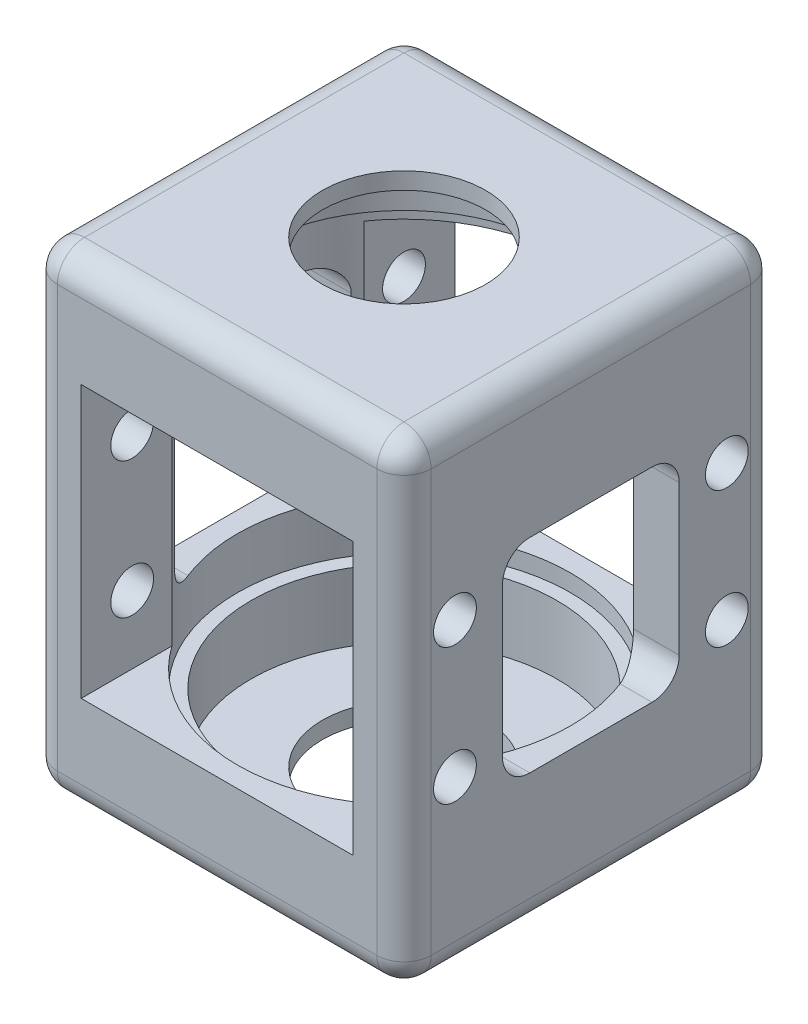
from build123d import *

# Parameters (mm, degrees)
SKETCH1_W               = 34.925
SKETCH1_H               = 34.925
SKETCH1_R               = 7.62
BOSS_EXTRUDE1_DEPTH     = 44.45
SKETCH2_W               = 25.4
SKETCH2_H               = 25.4
CUT_EXTRUDE1_DEPTH      = 44.45
CUT_EXTRUDE2_DEPTH      = 27.0002
CUT_EXTRUDE2_DEPTH_BACK = 1.6002
SKETCH3_R               = 15.5575
CUT_EXTRUDE3_DEPTH      = 34.9504
CUT_EXTRUDE3_DEPTH_BACK = 6.35
SKETCH4_R               = 14.2875
SKETCH5_W               = 16.51
SKETCH5_H               = 19.05
CUT_EXTRUDE4_DEPTH      = 228.6
SKETCH6_R               = 2
CUT_EXTRUDE5_DEPTH      = 228.6
FILLET1_R               = 2.54


with BuildPart() as part:
    # Sketch1 → Boss-Extrude1 (new body)
    with BuildSketch(Plane(origin=(0, 0, 0), x_dir=(1, 0, 0), z_dir=(0, 1, 0))):
        Rectangle(SKETCH1_W, SKETCH1_H)
        Circle(SKETCH1_R, mode=Mode.SUBTRACT)
    extrude(amount=BOSS_EXTRUDE1_DEPTH)

    # Sketch2 → Cut-Extrude1 (cut)
    with BuildSketch(Plane.XY.offset(17.4625)):
        with Locations((0, 22.225)):
            Rectangle(SKETCH2_W, SKETCH2_H)
    extrude(amount=-CUT_EXTRUDE1_DEPTH, mode=Mode.SUBTRACT)

    # Sketch3 → Cut-Extrude2 (cut, two sides: drawn at the far end of the back side and taken through both)
    with BuildSketch(Plane(origin=(0, 9.525, 0), x_dir=(1, 0, 0), z_dir=(0, 1, 0)).offset(-CUT_EXTRUDE2_DEPTH_BACK)):
        Circle(SKETCH3_R)
    extrude(amount=CUT_EXTRUDE2_DEPTH + CUT_EXTRUDE2_DEPTH_BACK, mode=Mode.SUBTRACT)

    # Sketch4 → Cut-Extrude3 (cut, two sides: drawn at the far end of the back side and taken through both)
    with BuildSketch(Plane(origin=(0, 7.9248, 0), x_dir=(1, 0, 0), z_dir=(0, 1, 0)).offset(-CUT_EXTRUDE3_DEPTH_BACK)):
        Circle(SKETCH4_R)
    extrude(amount=CUT_EXTRUDE3_DEPTH + CUT_EXTRUDE3_DEPTH_BACK, mode=Mode.SUBTRACT)

    # Sketch5 → Cut-Extrude4 (cut)
    with BuildSketch(Plane.ZY.offset(17.4625)):
        with Locations((0, 22.225)):
            Rectangle(SKETCH5_W, SKETCH5_H)
    extrude(amount=-CUT_EXTRUDE4_DEPTH, mode=Mode.SUBTRACT)

    # Sketch6 → Cut-Extrude5 (cut)
    with BuildSketch(Plane.ZY.offset(17.4625)):
        with Locations((-12.7, 28.575)):
            Circle(SKETCH6_R)
        with Locations((-12.7, 15.875)):
            Circle(SKETCH6_R)
        with Locations((12.7, 15.875)):
            Circle(SKETCH6_R)
        with Locations((12.7, 28.575)):
            Circle(SKETCH6_R)
    extrude(amount=-CUT_EXTRUDE5_DEPTH, mode=Mode.SUBTRACT)

    # Fillet1
    fillet1_edges = [part.edges().sort_by_distance(p)[0] for p in [
        (15.324632691, 12.7, 8.255),
        (15.324632691, 12.7, -8.255),
        (15.324632691, 31.75, 8.255),
        (15.324632691, 31.75, -8.255),
        (-17.4625, 0, 0),
        (-17.4625, 22.225, 17.4625),
        (0, 44.45, 17.4625),
        (17.4625, 44.45, 0),
        (17.4625, 22.225, 17.4625),
        (0, 0, 17.4625),
        (0, 0, -17.4625),
        (17.4625, 0, 0),
        (17.4625, 22.225, -17.4625),
        (-17.4625, 22.225, -17.4625),
        (0, 44.45, -17.4625),
        (-17.4625, 44.45, 0),
        (-15.324632691, 12.7, -8.255),
        (-15.324632691, 12.7, 8.255),
        (-15.324632691, 31.75, 8.255),
        (-15.324632691, 31.75, -8.255),
    ]]
    fillet(fillet1_edges, radius=FILLET1_R)


solid = part.part
